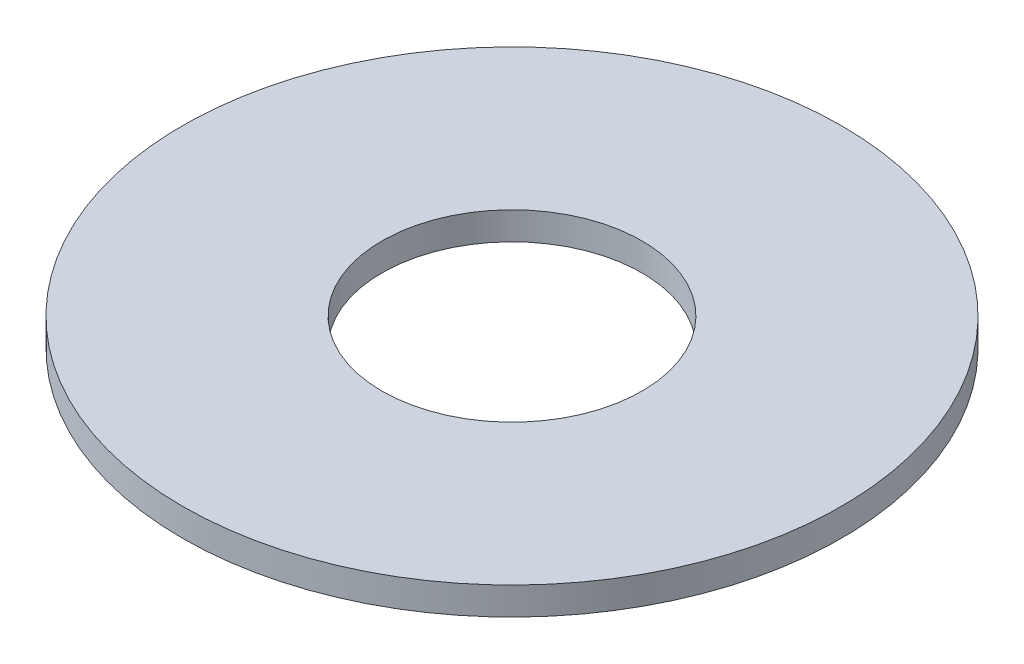
from build123d import *

# Parameters (mm, degrees)
SKETCH1_R           = 95
BOSS_EXTRUDE1_DEPTH = 8
SKETCH2_R           = 37.5
CUT_EXTRUDE1_DEPTH  = 135.588261004


with BuildPart() as part:
    # Sketch1 → Boss-Extrude1 (new body)
    with BuildSketch(Plane(origin=(0, 0, 0), x_dir=(1, 0, 0), z_dir=(0, 1, 0))):
        Circle(SKETCH1_R)
    extrude(amount=BOSS_EXTRUDE1_DEPTH)

    # Sketch2 → Cut-Extrude1 (cut, through all)
    with BuildSketch(Plane(origin=(0, 0, 0), x_dir=(1, 0, 0), z_dir=(0, 1, 0))):
        Circle(SKETCH2_R)
    extrude(amount=CUT_EXTRUDE1_DEPTH, mode=Mode.SUBTRACT)


solid = part.part
